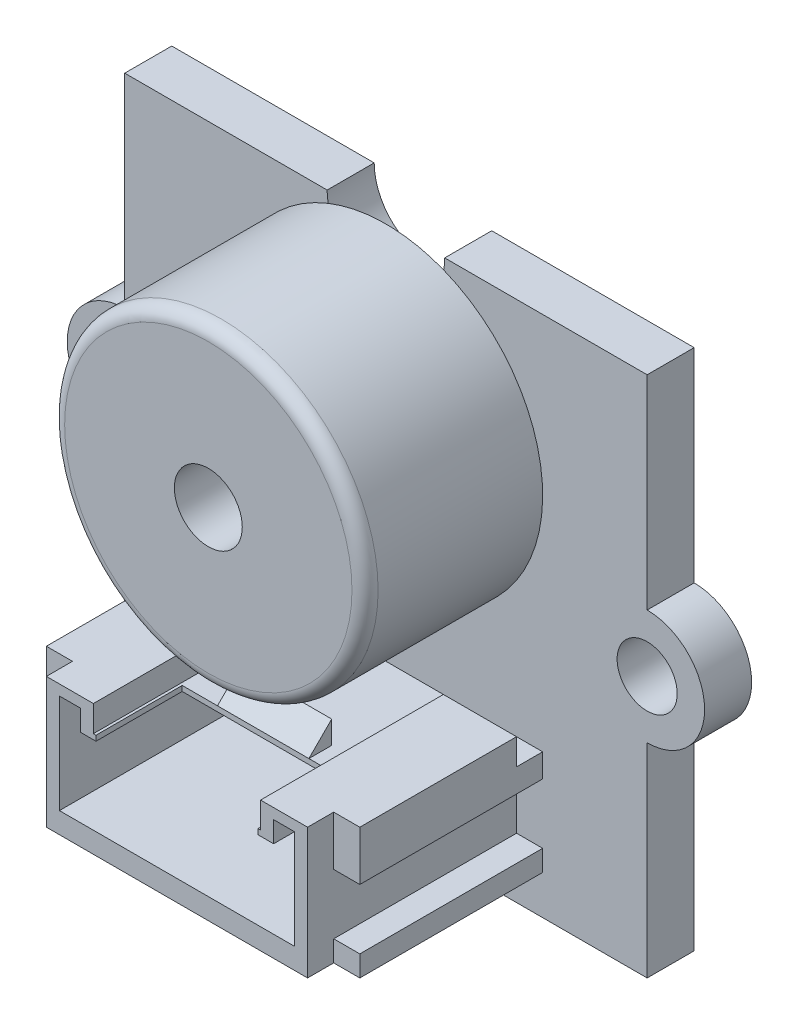
from build123d import *

# Parameters (mm, degrees)
ESQUISSE1_R             = 1.15
BOSS_EXTRU_1_DEPTH      = 1.8
BOSS_EXTRU_2_DEPTH      = 8
ENL_V_MAT_EXTRU_1_DEPTH = 7
ESQUISSE4_W             = 3.5
ESQUISSE4_H             = 0.873592076
ENL_V_MAT_EXTRU_2_DEPTH = 1
ESQUISSE5_W             = 1
ESQUISSE5_H             = 1
ENL_V_MAT_EXTRU_3_DEPTH = 11
ESQUISSE6_W             = 6.2
ESQUISSE6_H             = 3.3
ENL_V_MAT_EXTRU_4_DEPTH = 1
CHANFREIN1_SIZE         = 1
ESQUISSE7_R             = 6
BOSS_EXTRU_3_DEPTH      = 6.8
CONG_1_R                = 0.5
ESQUISSE8_R             = 1.3
ENL_V_MAT_EXTRU_5_DEPTH = 2


with BuildPart() as part:
    # Esquisse1 → Boss.-Extru.1 (new body)
    with BuildSketch(Plane.XY):
        with BuildLine():
            Line((-12.744645331, 10.992907801), (-4.994645331, 10.992907801))
            ThreePointArc((-4.994645331, 10.992907801), (-2.744645331, 8.742907801), (-0.494645331, 10.992907801))
            Line((-0.494645331, 10.992907801), (7.255354669, 10.992907801))
            Line((7.255354669, 10.992907801), (7.255354669, 3.192907801))
            ThreePointArc((7.255354669, 3.192907801), (9.455354669, 0.992907801), (7.255354669, -1.207092199))
            Line((7.255354669, -1.207092199), (7.255354669, -9.007092199))
            Line((7.255354669, -9.007092199), (-0.494645331, -9.007092199))
            ThreePointArc((-0.494645331, -9.007092199), (-2.744645331, -6.757092199), (-4.994645331, -9.007092199))
            Line((-4.994645331, -9.007092199), (-12.744645331, -9.007092199))
            Line((-12.744645331, -9.007092199), (-12.744645331, -1.207092199))
            ThreePointArc((-12.744645331, -1.207092199), (-14.944645331, 0.992907801), (-12.744645331, 3.192907801))
            Line((-12.744645331, 3.192907801), (-12.744645331, 10.992907801))
        make_face()
        with Locations((-12.744645331, 0.992907801)):
            Circle(ESQUISSE1_R, mode=Mode.SUBTRACT)
        with Locations((7.255354669, 0.992907801)):
            Circle(ESQUISSE1_R, mode=Mode.SUBTRACT)
    extrude(amount=BOSS_EXTRU_1_DEPTH)

    # Esquisse2 → Boss.-Extru.2 (add)
    with BuildSketch(Plane.XY.offset(1.8)):
        Polygon((-8.744645331, -7.507092199), (3.255354669, -7.507092199), (3.255354669, -6.707092199), (2.255354669, -6.707092199), (2.255354669, -4.407092199), (3.255354669, -4.407092199), (3.255354669, -2.507092199), (-8.744645331, -2.507092199), (-8.744645331, -4.407092199), (-7.744645331, -4.407092199), (-7.744645331, -6.707092199), (-8.744645331, -6.707092199), align=None)
    extrude(amount=BOSS_EXTRU_2_DEPTH)

    # Esquisse3 → Enlèv. mat.-Extru.1 (cut)
    with BuildSketch(Plane.XY.offset(9.8)):
        Polygon((-6.444645331, -3.707092199), (0.955354669, -3.707092199), (0.955354669, -2.907092199), (1.755354669, -2.907092199), (1.755354669, -3.707092199), (1.755354669, -6.707092199), (-7.244645331, -6.707092199), (-7.244645331, -3.707092199), (-7.244645331, -2.907092199), (-6.444645331, -2.907092199), align=None)
    extrude(amount=-ENL_V_MAT_EXTRU_1_DEPTH, mode=Mode.SUBTRACT)

    # Esquisse4 → Enlèv. mat.-Extru.2 (cut)
    with BuildSketch(Plane(origin=(0, -2.507092199, 0), x_dir=(1, 0, 0), z_dir=(0, 1, 0))):
        Polygon((-8.744645331, -1.8), (3.255354669, -1.8), (3.255354669, -2.8), (0.455354669, -2.8), (0.455354669, -9.8), (-5.944645331, -9.8), (-5.944645331, -2.8), (-8.744645331, -2.8), align=None)
        with Locations((-2.744645331, -6.063203962)):
            Rectangle(ESQUISSE4_W, ESQUISSE4_H, mode=Mode.SUBTRACT)
    extrude(amount=-ENL_V_MAT_EXTRU_2_DEPTH, mode=Mode.SUBTRACT)

    # Esquisse5 → Enlèv. mat.-Extru.3 (cut)
    with BuildSketch(Plane(origin=(0, -2.507092199, 0), x_dir=(1, 0, 0), z_dir=(0, 1, 0))):
        with Locations((-8.244645331, -9.3)):
            Rectangle(ESQUISSE5_W, ESQUISSE5_H)
        with Locations((2.755354669, -9.3)):
            Rectangle(ESQUISSE5_W, ESQUISSE5_H)
    extrude(amount=-ENL_V_MAT_EXTRU_3_DEPTH, mode=Mode.SUBTRACT)

    # Esquisse6 → Enlèv. mat.-Extru.4 (cut)
    with BuildSketch(Plane(origin=(0, -3.507092199, 0), x_dir=(1, 0, 0), z_dir=(0, 1, 0))):
        with Locations((-2.744645331, -8.15)):
            Rectangle(ESQUISSE6_W, ESQUISSE6_H)
    extrude(amount=-ENL_V_MAT_EXTRU_4_DEPTH, mode=Mode.SUBTRACT)

    # Chanfrein1
    # the kernel refuses this chamfer: 1 mm, written as the material it takes off along each edge
    with BuildSketch(Plane(origin=(1.577037657, -2.507092199, 6.5), x_dir=(0, -0.9996219169112968, 0.027495876610586487), z_dir=(-1, 0, 0))) as chanfrein1_piece_1_section:
        Polygon((CHANFREIN1_SIZE * 0.999621916911, -CHANFREIN1_SIZE * 0.0274958766106), (-CHANFREIN1_SIZE * 0.0274958766106, -CHANFREIN1_SIZE * 0.999621916911), (0, 0), align=None)
    chanfrein1_piece_1 = extrude(amount=6.071682988, mode=Mode.PRIVATE)
    chanfrein1_piece_1 = split(chanfrein1_piece_1, bisect_by=Plane(origin=(0.455354669, -3.107092199, 6.3), z_dir=(-1, 0, 0)), keep=Keep.TOP, mode=Mode.PRIVATE)
    add(chanfrein1_piece_1, mode=Mode.SUBTRACT)

    # Esquisse7 → Boss.-Extru.3 (add)
    with BuildSketch(Plane.XY.offset(1.8)):
        with Locations(Location((-2.744645331, 4.992907801, 0), (0, 0, 111.61384575))):
            Circle(ESQUISSE7_R)
    extrude(amount=BOSS_EXTRU_3_DEPTH)

    # Congé1
    cong_1_edges = [part.edges().sort_by_distance(p)[0] for p in [
        (-0.534549974, -0.585217199, 8.6),
    ]]
    fillet(cong_1_edges, radius=CONG_1_R)

    # Esquisse8 → Enlèv. mat.-Extru.5 (cut)
    with BuildSketch(Plane.XY.offset(8.6)):
        with Locations((-2.744645331, 4.992907801)):
            Circle(ESQUISSE8_R)
    extrude(amount=-ENL_V_MAT_EXTRU_5_DEPTH, mode=Mode.SUBTRACT)


solid = part.part
